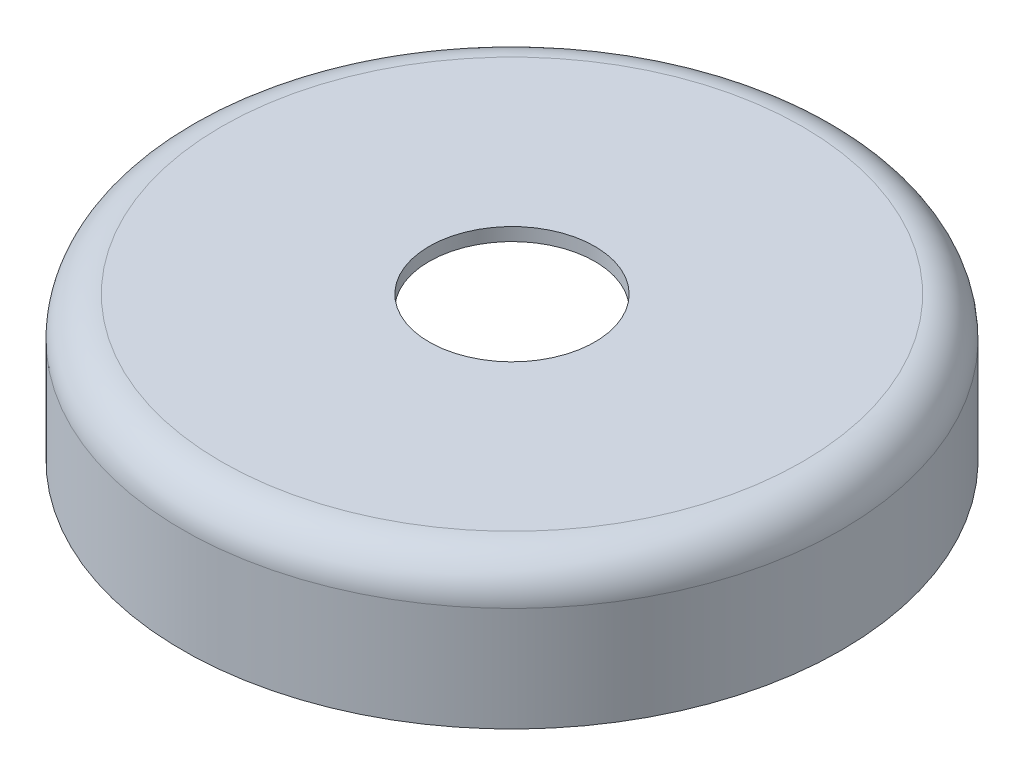
from build123d import *

# Parameters (mm, degrees)
SKETCH1_W     = 17.15
SKETCH1_H     = 1
THREAD1_PITCH = 2.5
FILLET1_R     = 3


with BuildPart() as part:
    # Sketch1 → Revolve1 (revolve)
    with BuildSketch(Plane.XY, mode=Mode.PRIVATE) as revolve1_sk:
        with Locations((14.925, 10.5)):
            Rectangle(SKETCH1_W, SKETCH1_H)
        Polygon((23.5, 11), (23.5, 10), (23.5, 0), (25.25, 0), (25.25, 11), align=None)
    revolve(revolve1_sk.sketch.rotate(Axis((0, 10, 0), (0, -1, 0)), 180), axis=Axis((0, 10, 0), (0, -1, 0)))

    # Thread1: the profile of Thread Profile1 profile screwed along a right-hand helix of 4 turns, 10 arcs to a turn; built about Z, then put on its axis
    thread1_z = Axis((0, 0, 0), (0, 0, 1))
    thread1_corners = [(23.4997, 0, -0.000173205), (24.853164688, 0, 0.781249997), (24.853164688, 0, 1.093749997), (23.4997, 0, 1.875173198)]
    with BuildLine(mode=Mode.PRIVATE) as thread1_profile:
        Line(thread1_corners[0], thread1_corners[1])
        Line(thread1_corners[1], thread1_corners[2])
        Line(thread1_corners[2], thread1_corners[3])
        Line(thread1_corners[3], thread1_corners[0])
    thread1_cap = Face(thread1_profile.wire())
    thread1_turn_angles = [0, 18, 36, 54, 72, 90, 108, 126, 144, 162, 180, 198, 216, 234, 252, 270, 288, 306, 324, 342, 360]
    thread1_turn_weights = [1, 0.9510565162951535, 1, 0.9510565162951535, 1, 0.9510565162951535, 1, 0.9510565162951535, 1, 0.9510565162951535, 1, 0.9510565162951535, 1, 0.9510565162951535, 1, 0.9510565162951535, 1, 0.9510565162951535, 1, 0.9510565162951535, 1]
    thread1_turn_rails = [Edge.make_bspline([Vector(p[0], p[1], 0).rotate(thread1_z, thread1_turn_angles[k]) / thread1_turn_weights[k] + Vector(0, 0, p[2] + THREAD1_PITCH * thread1_turn_angles[k] / 360) for k in range(21)], [0, 0, 0, 1, 1, 2, 2, 3, 3, 4, 4, 5, 5, 6, 6, 7, 7, 8, 8, 9, 9, 10, 10, 10], 2, thread1_turn_weights) for p in thread1_corners]
    thread1_turn_sides = [Face.make_surface_from_curves(thread1_turn_rails[p[0]], thread1_turn_rails[p[1]]) for p in [(0, 1), (1, 2), (2, 3), (3, 0)]]
    thread1 = Plane(origin=(0, -2.5, 0), x_dir=(1, 0, 0), z_dir=(0, 1, 0)) * Solid(Shell([*[p.moved(Location((0, 0, THREAD1_PITCH * i))) for i in range(4) for p in thread1_turn_sides], thread1_cap, thread1_cap.rotate(thread1_z, 1440).moved(Location((0, 0, THREAD1_PITCH * 1440 / 360)))]))
    add(thread1, mode=Mode.SUBTRACT)

    # Fillet1
    fillet1_edges = [part.edges().sort_by_distance(p)[0] for p in [
        (25.25, 11, 0),
    ]]
    fillet(fillet1_edges, radius=FILLET1_R)


solid = part.part
